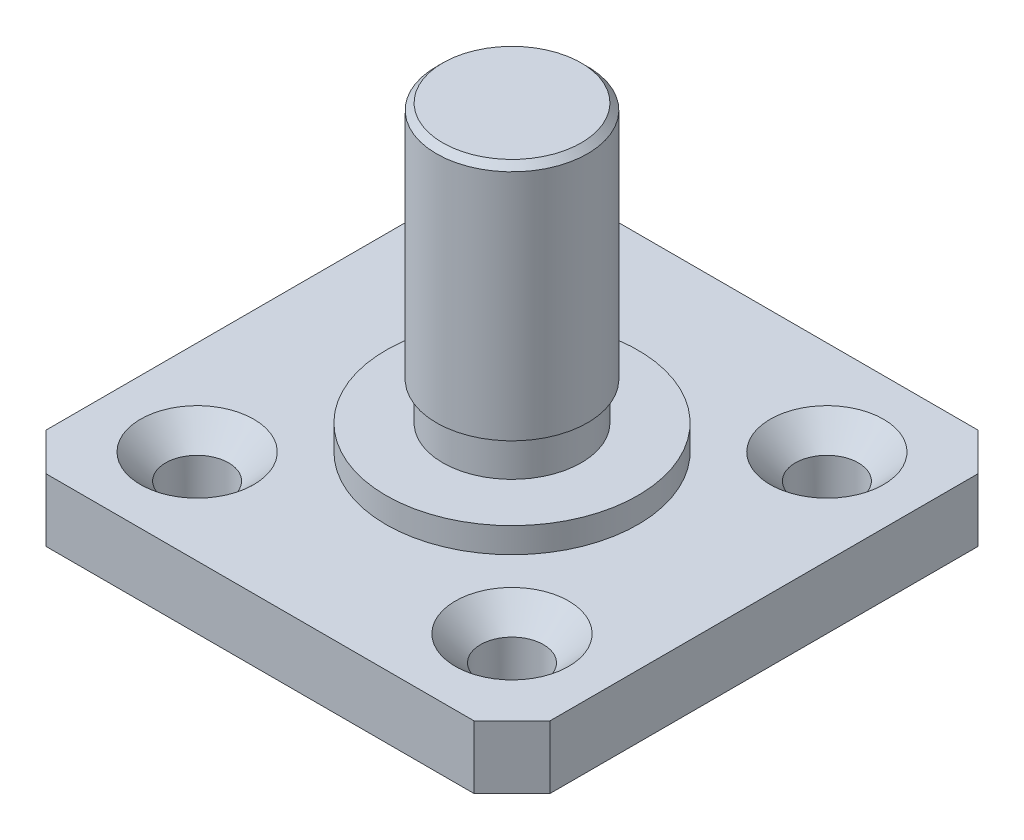
from build123d import *

# Parameters (mm, degrees)
SKETCH_1_W          = 40
SKETCH_1_H          = 40
EXTRUDE_1_DEPTH     = 5
CHAMFER_1_SIZE      = 3
SKETCH_2_R          = 10
EXTRUDE_2_DEPTH     = 2
SKETCH_3_R          = 6
EXTRUDE_3_DEPTH     = 22
SKETCH_4_R          = 6
SKETCH_4_R_2        = 5.5
CUT_EXTRUDE_1_DEPTH = 3
SKETCH_5_R          = 2.5
CUT_EXTRUDE_2_DEPTH = 38.094473982
CHAMFER_2_SIZE      = 2
CHAMFER_3_SIZE      = 0.5


with BuildPart() as part:
    # Эскиз1 → Бобышка-Вытянуть1 (new body)
    with BuildSketch(Plane(origin=(0, 0, 0), x_dir=(1, 0, 0), z_dir=(0, 1, 0))):
        Rectangle(SKETCH_1_W, SKETCH_1_H)
    extrude(amount=EXTRUDE_1_DEPTH)

    # Фаска1
    chamfer_1_edges = [part.edges().sort_by_distance(p)[0] for p in [
        (-20, 2.5, -20),
        (20, 2.5, -20),
        (-20, 2.5, 20),
        (20, 2.5, 20),
    ]]
    chamfer(chamfer_1_edges, length=CHAMFER_1_SIZE)

    # Эскиз2 → Бобышка-Вытянуть2 (add)
    with BuildSketch(Plane(origin=(0, 5, 0), x_dir=(1, 0, 0), z_dir=(0, 1, 0))):
        Circle(SKETCH_2_R)
    extrude(amount=EXTRUDE_2_DEPTH)

    # Эскиз3 → Бобышка-Вытянуть3 (add)
    with BuildSketch(Plane(origin=(0, 7, 0), x_dir=(1, 0, 0), z_dir=(0, 1, 0))):
        Circle(SKETCH_3_R)
    extrude(amount=EXTRUDE_3_DEPTH)

    # Эскиз4 → Вырез-Вытянуть1 (cut)
    with BuildSketch(Plane(origin=(0, 7, 0), x_dir=(1, 0, 0), z_dir=(0, 1, 0))):
        Circle(SKETCH_4_R)
        Circle(SKETCH_4_R_2, mode=Mode.SUBTRACT)
    extrude(amount=CUT_EXTRUDE_1_DEPTH, mode=Mode.SUBTRACT)

    # Эскиз5 → Вырез-Вытянуть2 (cut, through all)
    with BuildSketch(Plane(origin=(0, 5, 0), x_dir=(1, 0, 0), z_dir=(0, 1, 0))):
        with Locations((-12.5, 12.5)):
            Circle(SKETCH_5_R)
        with Locations((12.5, 12.5)):
            Circle(SKETCH_5_R)
        with Locations((12.5, -12.5)):
            Circle(SKETCH_5_R)
        with Locations((-12.5, -12.5)):
            Circle(SKETCH_5_R)
    extrude(amount=-CUT_EXTRUDE_2_DEPTH, mode=Mode.SUBTRACT)

    # Фаска2
    chamfer_2_edges = [part.edges().sort_by_distance(p)[0] for p in [
        (-15, 5, 12.5),
        (10, 5, 12.5),
        (10, 5, -12.5),
        (-15, 5, -12.5),
    ]]
    chamfer(chamfer_2_edges, length=CHAMFER_2_SIZE)

    # Фаска3
    chamfer_3_edges = [part.edges().sort_by_distance(p)[0] for p in [
        (-6, 29, 0),
    ]]
    chamfer(chamfer_3_edges, length=CHAMFER_3_SIZE)


solid = part.part
